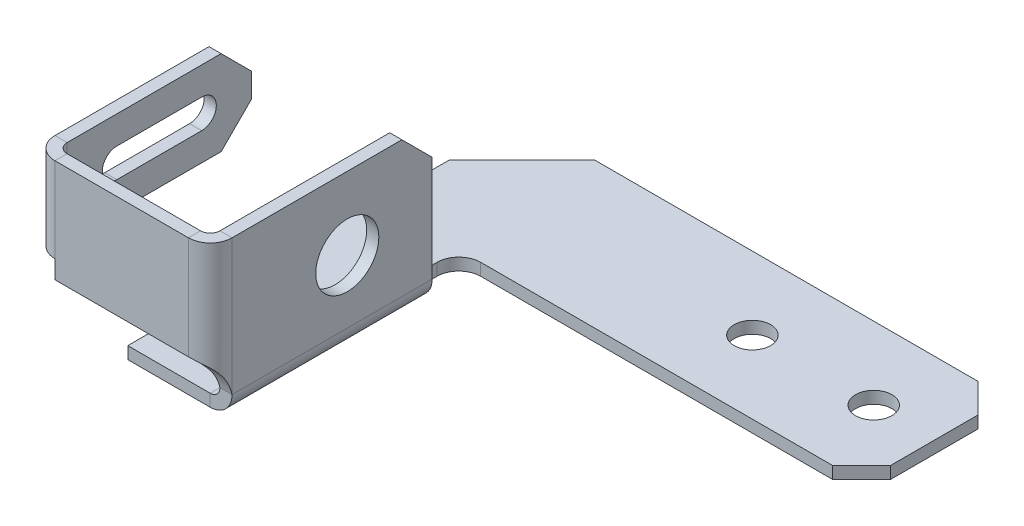
from build123d import *

# Parameters (mm, degrees)
BASE_FLANGE1_DEPTH      = 56
SKETCH9_W               = 85
SKETCH9_H               = 21
CUT_EXTRUDE2_DEPTH      = 9
CUT_EXTRUDE3_DEPTH      = 10
SKETCH11_R              = 13
CUT_EXTRUDE4_DEPTH      = 10
BREAK_CORNER1_START     = -68
BREAK_CORNER1_DEPTH     = 5
BREAK_CORNER1_2_DEPTH   = 5
EDGE_FLANGE1_DEPTH      = 82.5
EDGE_FLANGE1_START      = -5
EDGE_FLANGE1_PROFILE_W  = 102.5
EDGE_FLANGE1_PROFILE_H  = 34
EDGE_FLANGE1_FLAT_DEPTH = 5
SKETCH15_W              = 200
SKETCH15_H              = 60
SKETCH15_R              = 7.5
BOSS_EXTRUDE1_DEPTH     = 5
BREAK_CORNER2_START     = -144.603336753
BREAK_CORNER2_OUTLINE_W = 46
BREAK_CORNER2_OUTLINE_H = 8
BREAK_CORNER2_DEPTH     = 21.213203436
BREAK_CORNER3_START     = -9
BREAK_CORNER3_DEPTH     = 5
CUT_EXTRUDE5_DEPTH      = 236.599766553
FILLET1_R               = 9


# Read off the part's stored shape, not the designer's step: Break-Corner1, Break-Corner2, Break-Corner3
# Sheet-metal steps are written as plain solids
with BuildPart() as part:
    # Sketch1 → Base-Flange1 (new body)
    with BuildSketch(Plane(origin=(0, 0, 0), x_dir=(1, 0, 0), z_dir=(0, 1, 0))):
        with BuildLine():
            Line((-63, 80), (-63, 4))
            ThreePointArc((-63, 4), (-61.828427125, 1.171572875), (-59, 0))
            Line((-59, 0), (-4, 0))
            ThreePointArc((-4, 0), (-1.171572875, 1.171572875), (0, 4))
            Line((0, 4), (0, 86.5))
            Line((0, 86.5), (5, 86.5))
            Line((5, 86.5), (5, 4))
            ThreePointArc((5, 4), (2.363961031, -2.363961031), (-4, -5))
            Line((-4, -5), (-59, -5))
            ThreePointArc((-59, -5), (-65.363961031, -2.363961031), (-68, 4))
            Line((-68, 4), (-68, 80))
            Line((-68, 80), (-63, 80))
        make_face()
    extrude(amount=BASE_FLANGE1_DEPTH)

    # Sketch9 → Cut-Extrude2 (cut)
    with BuildSketch(Plane.ZY.offset(68)):
        with Locations((-37.5, 10.5)):
            Rectangle(SKETCH9_W, SKETCH9_H)
    extrude(amount=-CUT_EXTRUDE2_DEPTH, mode=Mode.SUBTRACT)

    # Sketch10 → Cut-Extrude3 (cut)
    with BuildSketch(Plane(origin=(-63, 0, 0), x_dir=(0, 0, -1), z_dir=(1, 0, 0))):
        with BuildLine():
            Line((24.5, 44.5), (59.5, 44.5))
            ThreePointArc((59.5, 44.5), (65.5, 38.5), (59.5, 32.5))
            Line((59.5, 32.5), (24.5, 32.5))
            ThreePointArc((24.5, 32.5), (18.5, 38.5), (24.5, 44.5))
        make_face()
    extrude(amount=-CUT_EXTRUDE3_DEPTH, mode=Mode.SUBTRACT)

    # Sketch11 → Cut-Extrude4 (cut)
    with BuildSketch(Plane(origin=(5, 0, 0), x_dir=(0, 0, -1), z_dir=(1, 0, 0))):
        with Locations((51.5, 26)):
            Circle(SKETCH11_R)
    extrude(amount=-CUT_EXTRUDE4_DEPTH, mode=Mode.SUBTRACT)

    # Break-Corner1 outline → Break-Corner1 (cut)
    with BuildSketch(Plane.YZ.offset(BREAK_CORNER1_START)):
        Polygon((21, -80), (33.5, -80), (21, -67.5), align=None)
        Polygon((56, -67.5), (43.5, -80), (56, -80), align=None)
    extrude(amount=BREAK_CORNER1_DEPTH, mode=Mode.SUBTRACT)

    # Break-Corner1 2 outline → Break-Corner1 2 (cut)
    with BuildSketch(Plane.YZ):
        Polygon((56, -86.5), (56, -74), (43.5, -86.5), align=None)
    extrude(amount=BREAK_CORNER1_2_DEPTH, mode=Mode.SUBTRACT)

    # Edge-Flange1 bend section (across the edge) → Edge-Flange1 (add)
    with BuildSketch(Plane(origin=(0, -4, -86.5), x_dir=(0, 1, 0), z_dir=(0, 0, 1))):
        with BuildLine():
            Line((-5, 4), (0, 4))
            ThreePointArc((0, 4), (1.171572875, 1.171572875), (4, 0))
            Line((4, 0), (4, -5))
            ThreePointArc((4, -5), (-2.363961031, -2.363961031), (-5, 4))
        make_face()
    extrude(amount=EDGE_FLANGE1_DEPTH)

    # Edge-Flange1 profile (on flange) → Edge-Flange1 flat (add)
    with BuildSketch(Plane(origin=(0, -4, 0), x_dir=(0, 0, -1), z_dir=(0, 1, 0)).offset(EDGE_FLANGE1_START)):
        with Locations((55.25, 21)):
            Rectangle(EDGE_FLANGE1_PROFILE_W, EDGE_FLANGE1_PROFILE_H)
    extrude(amount=EDGE_FLANGE1_FLAT_DEPTH)

    # Sketch15 → Boss-Extrude1 (add)
    with BuildSketch(Plane(origin=(0, -4, 0), x_dir=(1, 0, 0), z_dir=(0, 1, 0))):
        with Locations((62, 136.5)):
            Rectangle(SKETCH15_W, SKETCH15_H)
        with Locations(Location((87, 136.5, 0), (0, 0, 180))):
            Circle(SKETCH15_R, mode=Mode.SUBTRACT)
        with Locations(Location((137, 136.5, 0), (0, 0, 180))):
            Circle(SKETCH15_R, mode=Mode.SUBTRACT)
    extrude(amount=-BOSS_EXTRUDE1_DEPTH)

    # Break-Corner2 outline → Break-Corner2 (cut)
    with BuildSketch(Plane(origin=(0, 0, 0), x_dir=(0.7071067811865471, 0, -0.707106781186548), z_dir=(0.707106781186548, 0, 0.707106781186547)).offset(BREAK_CORNER2_START)):
        with Locations((91, -7)):
            Rectangle(BREAK_CORNER2_OUTLINE_W, BREAK_CORNER2_OUTLINE_H)
    extrude(amount=BREAK_CORNER2_DEPTH, mode=Mode.SUBTRACT)

    # Break-Corner3 outline → Break-Corner3 (cut)
    with BuildSketch(Plane(origin=(0, 0, 0), x_dir=(1, 0, 0), z_dir=(0, 1, 0)).offset(BREAK_CORNER3_START)):
        Polygon((162, 106.5), (162, 118.5), (150, 106.5), align=None)
        Polygon((150, 166.5), (162, 154.5), (162, 166.5), align=None)
    extrude(amount=BREAK_CORNER3_DEPTH, mode=Mode.SUBTRACT)

    # Sketch16 → Cut-Extrude5 (cut, through all)
    with BuildSketch(Plane(origin=(5, 0, 0), x_dir=(0, 0, -1), z_dir=(1, 0, 0))):
        with BuildLine():
            Line((-5, 13.5), (-5, 0))
            Line((-5, 0), (4, 0))
            ThreePointArc((4, 0), (0.759222528, 7.589481685), (-5, 13.5))
        make_face()
    extrude(amount=-CUT_EXTRUDE5_DEPTH, mode=Mode.SUBTRACT)

    # Fillet1
    fillet1_edges = [part.edges().sort_by_distance(p)[0] for p in [
        (-4, -6.5, -106.5),
    ]]
    fillet(fillet1_edges, radius=FILLET1_R)


solid = part.part
